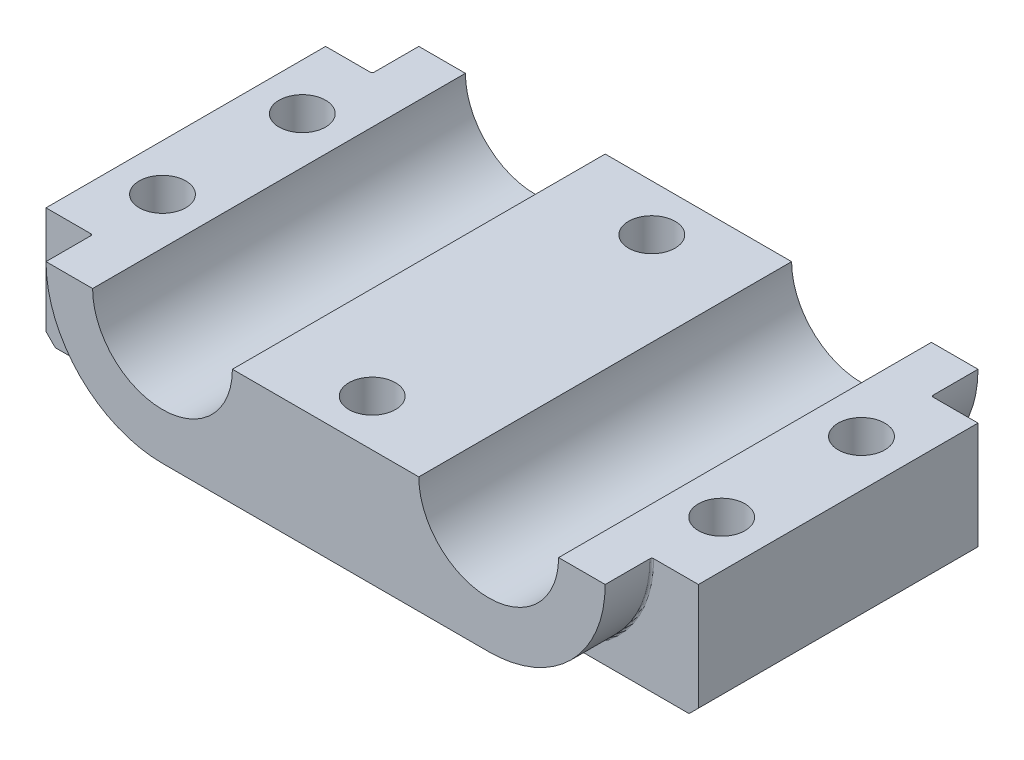
from build123d import *

# Parameters (mm, degrees)
EXTRUDE_1_DEPTH      = 20
EXTRUDE_1_DEPTH_BACK = 20
EXTRUDE_2_DEPTH      = 15
EXTRUDE_2_DEPTH_BACK = 15
CHAMFER_1_SIZE       = 1
HOLE_WIZARD_5_0_1_D  = 5
FILLET_1_R           = 0.2


with BuildPart() as part:
    # Эскиз1 → Бобышка-Вытянуть1 (new, two sides: drawn at the far end of the back side and taken through both)
    with BuildSketch(Plane.XY.offset(-EXTRUDE_1_DEPTH_BACK)):
        with BuildLine():
            Line((17.5, -12.5), (-17.5, -12.5))
            ThreePointArc((-17.5, -12.5), (-26.338834764831844, -8.838834764831844), (-30.000000000000004, 0))
            Line((-30.000000000000004, 0), (-25, 0))
            ThreePointArc((-25, 0), (-17.5, -7.499999999999998), (-10.000000000000002, 0))
            Line((-10.000000000000002, 0), (10.000000000000002, 0))
            ThreePointArc((10.000000000000002, 0), (17.5, -7.499999999999998), (25, 0))
            Line((25, 0), (30.000000000000004, 0))
            ThreePointArc((30.000000000000004, 0), (26.338834764831844, -8.838834764831843), (17.5, -12.5))
        make_face()
    extrude(amount=EXTRUDE_1_DEPTH + EXTRUDE_1_DEPTH_BACK)

    # Эскиз2 → Бобышка-Вытянуть2 (add, two sides: drawn at the far end of the back side and taken through both)
    with BuildSketch(Plane.XY.offset(-EXTRUDE_2_DEPTH_BACK)):
        with BuildLine():
            Line((30.000000000000004, 0), (35, 0))
            Line((35, 0), (35, -12.499999999999996))
            Line((35, -12.499999999999996), (17.5, -12.5))
            Line((17.5, -12.5), (-17.500000000000004, -12.5))
            Line((-17.500000000000004, -12.5), (-35, -12.499999999999996))
            Line((-35, -12.499999999999996), (-35, 0))
            Line((-35, 0), (-30.000000000000004, 1.53e-15))
            Line((-30.000000000000004, 1.53e-15), (-25, 9.2e-16))
            ThreePointArc((-25, 9.2e-16), (-17.5, -7.499999999999998), (-10.000000000000002, 0))
            Line((-10.000000000000002, 0), (10.000000000000002, 9.2e-16))
            ThreePointArc((10.000000000000002, 9.2e-16), (17.5, -7.499999999999998), (25, 0))
            Line((25, 0), (30.000000000000004, 0))
        make_face()
    extrude(amount=EXTRUDE_2_DEPTH + EXTRUDE_2_DEPTH_BACK)

    # Фаска1
    chamfer_1_edges = [part.edges().sort_by_distance(p)[0] for p in [
        (35, -12.499999999999996, 0),
        (-35, -12.499999999999996, 0),
    ]]
    chamfer(chamfer_1_edges, length=CHAMFER_1_SIZE)

    # Отверстия под штифты Ø5.0 мм1 (through all)
    with Locations(Plane(origin=(0, 0, 0), x_dir=(1, 0, 0), z_dir=(0, 1, 0))):
        with Locations((0, 15), (0, -15), (-30, -7.5), (-30, 7.5), (30, 7.5), (30, -7.5)):
            Hole(HOLE_WIZARD_5_0_1_D / 2)

    # Скругление1
    # the kernel refuses this fillet: 0.2 mm, written as the material it adds along each edge
    with BuildSketch(Plane(origin=(-17.5, 4.44e-15, -15), x_dir=(0.19874807030113847, -0.9800506132601386, 0), z_dir=(0.9800506132601386, 0.19874807030113847, 0))) as fillet_1_piece_1_section:
        with BuildLine():
            CenterArc((12.500000000000004 + FILLET_1_R, FILLET_1_R), FILLET_1_R, 180, 90)
            Line((12.500000000000004, FILLET_1_R), (12.500000000000004, 0))
            Line((12.500000000000004, 0), (12.500000000000004 + FILLET_1_R, 0))
        make_face()
    fillet_1_piece_1 = revolve(axis=Axis((-17.5, 4.44e-15, -15), (0, 0, -1)), revolution_arc=101.46375913899153, mode=Mode.PRIVATE)
    fillet_1_piece_1 = split(fillet_1_piece_1, bisect_by=Plane(origin=(-17.5, -12.5, -15), z_dir=(0, 1, 0)), keep=Keep.TOP, mode=Mode.PRIVATE)
    add(fillet_1_piece_1)
    with BuildSketch(Plane(origin=(-17.5, 4.44e-15, 15), x_dir=(0.19874807030113847, -0.9800506132601386, 0), z_dir=(0.9800506132601386, 0.19874807030113847, 0))) as fillet_1_piece_2_section:
        with BuildLine():
            CenterArc((12.500000000000004 + FILLET_1_R, -FILLET_1_R), FILLET_1_R, 90, 90)
            Line((12.500000000000004, -FILLET_1_R), (12.500000000000004, 0))
            Line((12.500000000000004, 0), (12.500000000000004 + FILLET_1_R, 0))
        make_face()
    fillet_1_piece_2 = revolve(axis=Axis((-17.5, 4.44e-15, 15), (0, 0, -1)), revolution_arc=101.46375913899153, mode=Mode.PRIVATE)
    fillet_1_piece_2 = split(fillet_1_piece_2, bisect_by=Plane(origin=(-17.5, -12.5, 15), z_dir=(0, 1, 0)), keep=Keep.TOP, mode=Mode.PRIVATE)
    add(fillet_1_piece_2)
    with BuildSketch(Plane(origin=(17.499999999999993, 1.199e-14, 15), x_dir=(1, -9.6e-16, 0), z_dir=(9.6e-16, 1, 0))) as fillet_1_piece_3_section:
        with BuildLine():
            CenterArc((12.50000000000001 + FILLET_1_R, -FILLET_1_R), FILLET_1_R, 90, 90)
            Line((12.50000000000001 + FILLET_1_R, 0), (12.50000000000001, 0))
            Line((12.50000000000001, 0), (12.50000000000001, -FILLET_1_R))
        make_face()
    fillet_1_piece_3 = revolve(axis=Axis((17.499999999999993, 1.199e-14, 15), (0, 0, -1)), revolution_arc=101.46375913899143, mode=Mode.PRIVATE)
    fillet_1_piece_3 = split(fillet_1_piece_3, bisect_by=Plane(origin=(17.499999999999993, -12.5, 15), z_dir=(0, 1, 0)), keep=Keep.TOP, mode=Mode.PRIVATE)
    add(fillet_1_piece_3)
    with BuildSketch(Plane(origin=(17.499999999999993, 1.199e-14, -15), x_dir=(1, -9.6e-16, 0), z_dir=(9.6e-16, 1, 0))) as fillet_1_piece_4_section:
        with BuildLine():
            CenterArc((12.50000000000001 + FILLET_1_R, FILLET_1_R), FILLET_1_R, 180, 90)
            Line((12.50000000000001 + FILLET_1_R, 0), (12.50000000000001, 0))
            Line((12.50000000000001, 0), (12.50000000000001, FILLET_1_R))
        make_face()
    fillet_1_piece_4 = revolve(axis=Axis((17.499999999999993, 1.199e-14, -15), (0, 0, -1)), revolution_arc=101.46375913899143, mode=Mode.PRIVATE)
    fillet_1_piece_4 = split(fillet_1_piece_4, bisect_by=Plane(origin=(17.499999999999993, -12.5, -15), z_dir=(0, 1, 0)), keep=Keep.TOP, mode=Mode.PRIVATE)
    add(fillet_1_piece_4)


solid = part.part
